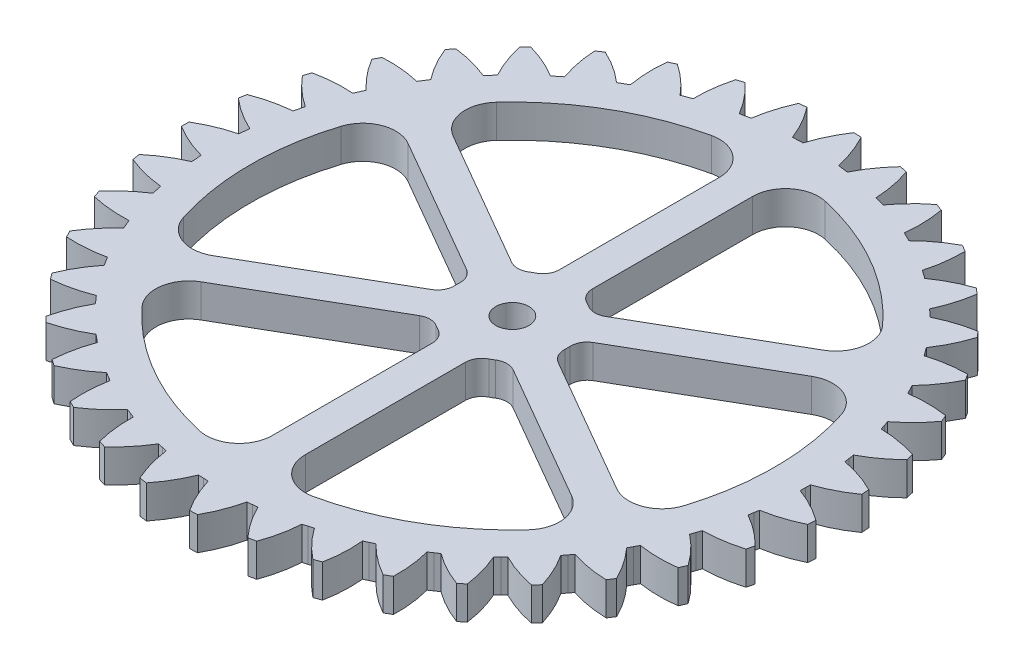
from build123d import *

# Parameters (mm, degrees)
BOSS_EXTRUDE1_DEPTH      = 1.5
CIRPATTERN2_COUNT        = 39
SKETCH3_R                = 1.5
CUT_EXTRUDE1_DEPTH       = 43.388110201
CUT_EXTRUDE2_DEPTH       = 43.388110201
FILLET1_R                = 3
FILLET2_R                = 1.5
CIRPATTERN1_COUNT        = 6
FILLET1_OF_CIRPATTERN1_R = 3
FILLET2_OF_CIRPATTERN1_R = 1.5


with BuildPart() as part:
    # Sketch5 → Boss-Extrude1 (new, symmetric)
    with BuildSketch(Plane(origin=(0, 0, 0), x_dir=(1, 0, 0), z_dir=(0, 1, 0))):
        with BuildLine():
            Line((0, 0), (26.449954509, 4.090817025))
            Line((26.449954509, 4.090817025), (26.520897753, 3.638243521))
            ThreePointArc((26.520897753, 3.638243521), (28.197939687, 3.197253599), (29.794725899, 2.521076439))
            Line((29.794725899, 2.521076439), (29.819813733, 2.177516055))
            Line((29.819813733, 2.177516055), (29.844901148, 1.833955641))
            ThreePointArc((29.844901148, 1.833955641), (28.363282087, 0.932985765), (26.768092937, 0.253049491))
            Line((26.768092937, 0.253049491), (26.763647744, -0.205029062))
            Line((26.763647744, -0.205029062), (0, 0))
        make_face()
    boss_extrude1 = extrude(amount=BOSS_EXTRUDE1_DEPTH, both=True)

    # CirPattern2: Boss-Extrude1 ×39 about axis
    cirpattern2_axis = Axis((0, -1.5, 0), (0, 1, 0))
    for i in range(1, CIRPATTERN2_COUNT):
        add(boss_extrude1.rotate(cirpattern2_axis, i * 360 / CIRPATTERN2_COUNT))

    # Sketch3 → Cut-Extrude1 (cut, through all)
    with BuildSketch(Plane(origin=(0, 1.5, 0), x_dir=(1, 0, 0), z_dir=(0, 1, 0))):
        Circle(SKETCH3_R)
    extrude(amount=-CUT_EXTRUDE1_DEPTH, mode=Mode.SUBTRACT)

    # Sketch4 → Cut-Extrude2 (cut, through all)
    with BuildSketch(Plane(origin=(0, 1.5, 0), x_dir=(1, 0, 0), z_dir=(0, 1, 0))):
        with BuildLine():
            Line((4.88067791, 1.085809898), (21.289565422, 10.55948552))
            ThreePointArc((21.289565422, 10.55948552), (23.764434147, 0), (21.289565422, -10.55948552))
            Line((21.289565422, -10.55948552), (4.88067791, -1.085809898))
            ThreePointArc((4.88067791, -1.085809898), (5, 0), (4.88067791, 1.085809898))
        make_face()
    cut_extrude2 = extrude(amount=-CUT_EXTRUDE2_DEPTH, mode=Mode.SUBTRACT)

    # Fillet1
    fillet1_edges = [part.edges().sort_by_distance(p)[0] for p in [
        (21.289565422, 0, 10.55948552),
        (21.289565422, 0, -10.55948552),
    ]]
    fillet(fillet1_edges, radius=FILLET1_R)

    # Fillet2
    fillet2_edges = [part.edges().sort_by_distance(p)[0] for p in [
        (4.88067791, 0, 1.085809898),
        (4.88067791, 0, -1.085809898),
    ]]
    fillet(fillet2_edges, radius=FILLET2_R)

    # CirPattern1: Cut-Extrude2 ×6 about axis
    cirpattern1_axis = Axis((0, -1.5, 0), (0, 1, 0))
    for i in range(1, CIRPATTERN1_COUNT):
        add(cut_extrude2.rotate(cirpattern1_axis, i * 360 / CIRPATTERN1_COUNT), mode=Mode.SUBTRACT)

    # Fillet1 of CirPattern1
    fillet1_of_cirpattern1_edges = [part.edges().sort_by_distance(p)[0] for p in [
        (19.789565422, 0, -13.157561731),
        (1.5, 0, -23.717047251),
        (-1.5, 0, -23.717047251),
        (-19.789565422, 0, -13.157561731),
        (-21.289565422, 0, -10.55948552),
        (-21.289565422, 0, 10.55948552),
        (-19.789565422, 0, 13.157561731),
        (-1.5, 0, 23.717047251),
        (1.5, 0, 23.717047251),
        (19.789565422, 0, 13.157561731),
    ]]
    fillet(fillet1_of_cirpattern1_edges, radius=FILLET1_OF_CIRPATTERN1_R)

    # Fillet2 of CirPattern1
    fillet2_of_cirpattern1_edges = [part.edges().sort_by_distance(p)[0] for p in [
        (3.38067791, 0, -3.683886109),
        (1.5, 0, -4.769696007),
        (-1.5, 0, -4.769696007),
        (-3.38067791, 0, -3.683886109),
        (-4.88067791, 0, -1.085809898),
        (-4.88067791, 0, 1.085809898),
        (-3.38067791, 0, 3.683886109),
        (-1.5, 0, 4.769696007),
        (1.5, 0, 4.769696007),
        (3.38067791, 0, 3.683886109),
    ]]
    fillet(fillet2_of_cirpattern1_edges, radius=FILLET2_OF_CIRPATTERN1_R)


solid = part.part
